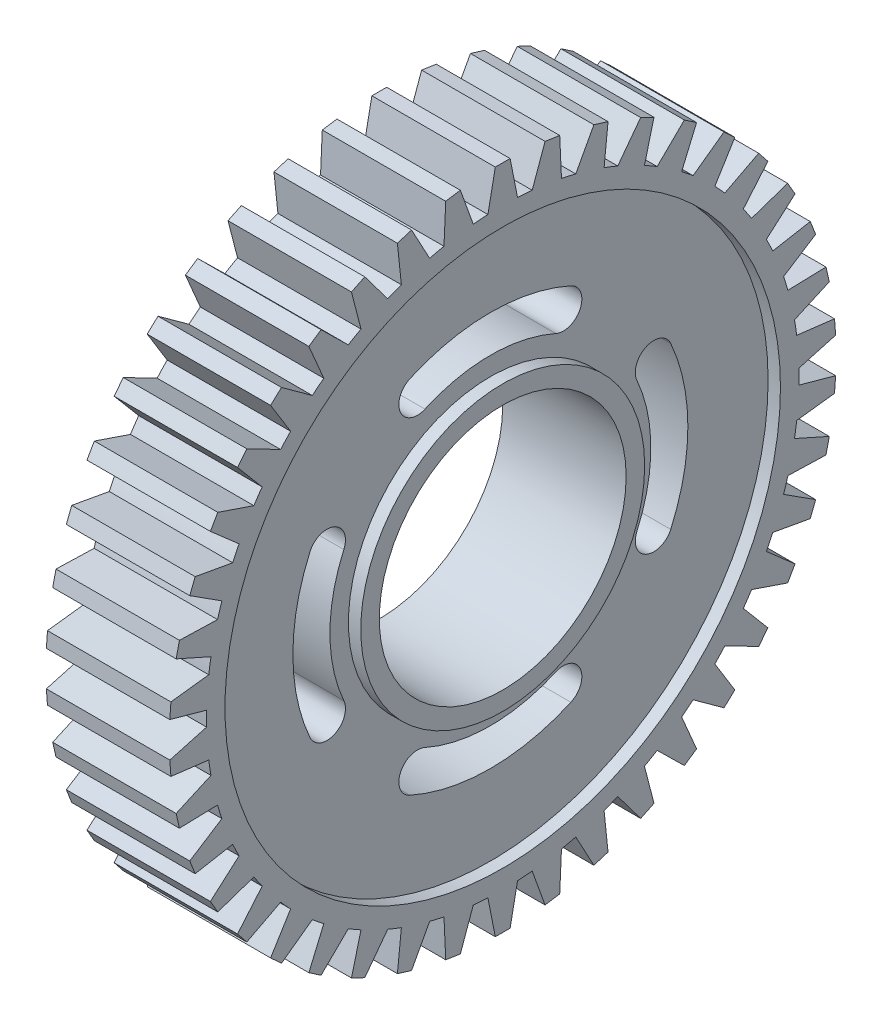
from build123d import *

# Parameters (mm, degrees)
SKETCH1_R           = 22.5
SKETCH1_R_2         = 16
SKETCH1_R_3         = 13
SKETCH1_R_4         = 10
SKETCH1_R_5         = 11.5
BOSS_EXTRUDE1_DEPTH = 4
SKETCH1_3_R         = 24
SKETCH1_3_R_2       = 22.5
SKETCH1_3_R_3       = 11.5
SKETCH1_3_R_4       = 10
BOSS_EXTRUDE2_DEPTH = 5
BOSS_EXTRUDE3_DEPTH = 5
CIRPATTERN2_COUNT   = 42
CUT_EXTRUDE1_DEPTH  = 40.208995541
FILLET1_START       = -4
FILLET1_DEPTH       = 8
FILLET2_START       = -4
FILLET2_DEPTH       = 8
CIRPATTERN3_COUNT   = 4


with BuildPart() as part:
    # Sketch1 → Boss-Extrude1 (new, symmetric)
    # profile 1 of 4: a face of its own
    with BuildSketch(Plane.YZ):
        with Locations(Location((0, 0, 0), (0, 0, 270))):
            Circle(SKETCH1_R)
        Circle(SKETCH1_R_2, mode=Mode.SUBTRACT)
    # profile 2 of 4: a face of its own
    with BuildSketch(Plane.YZ):
        Circle(SKETCH1_R_2)
        Circle(SKETCH1_R_3, mode=Mode.SUBTRACT)
    # profile 3 of 4: a face of its own
    with BuildSketch(Plane.YZ):
        Circle(SKETCH1_R_3)
        with Locations(Location((0, 0, 0), (0, 0, 270))):
            Circle(SKETCH1_R_4, mode=Mode.SUBTRACT)
    # profile 4 of 4: a face of its own
    with BuildSketch(Plane.YZ):
        Circle(SKETCH1_R_5)
        with Locations(Location((0, 0, 0), (0, 0, 270))):
            Circle(SKETCH1_R_4, mode=Mode.SUBTRACT)
    extrude(amount=BOSS_EXTRUDE1_DEPTH, both=True)

    # Sketch1<3> → Boss-Extrude2 (add, symmetric)
    # profile 1 of 2: a face of its own
    with BuildSketch(Plane.YZ):
        with Locations(Location((0, 0, 0), (0, 0, 270))):
            Circle(SKETCH1_3_R)
        with Locations(Location((0, 0, 0), (0, 0, 270))):
            Circle(SKETCH1_3_R_2, mode=Mode.SUBTRACT)
    # profile 2 of 2: a face of its own
    with BuildSketch(Plane.YZ):
        with Locations(Location((0, 0, 0), (0, 0, 270))):
            Circle(SKETCH1_3_R_3)
        with Locations(Location((0, 0, 0), (0, 0, 270))):
            Circle(SKETCH1_3_R_4, mode=Mode.SUBTRACT)
    extrude(amount=BOSS_EXTRUDE2_DEPTH, both=True)

    # Sketch1<4> → Boss-Extrude3 (add, symmetric)
    with BuildSketch(Plane.YZ):
        with BuildLine():
            Line((27, -0.6), (27, 0.6))
            Line((27, 0.6), (23.969981227, 1.2))
            ThreePointArc((23.969981227, 1.2), (23.992494133, 0.600187705), (24, 0))
            ThreePointArc((24, 0), (23.992494133, -0.600187705), (23.969981227, -1.2))
            Line((23.969981227, -1.2), (27, -0.6))
        make_face()
    boss_extrude3 = extrude(amount=BOSS_EXTRUDE3_DEPTH, both=True)

    # CirPattern2: Boss-Extrude3 ×42 about axis
    cirpattern2_axis = Axis((0, 0, 0), (1, 0, 0))
    for i in range(1, CIRPATTERN2_COUNT):
        add(boss_extrude3.rotate(cirpattern2_axis, i * 360 / CIRPATTERN2_COUNT))

    # Sketch2 → Cut-Extrude1 (cut, through all)
    with BuildSketch(Plane.YZ.offset(4)):
        with BuildLine():
            Line((-6.5, 11.258330249), (-8, 13.856406461))
            ThreePointArc((-8, 13.856406461), (0, 16), (8, 13.856406461))
            Line((8, 13.856406461), (6.5, 11.258330249))
            ThreePointArc((6.5, 11.258330249), (0, 13), (-6.5, 11.258330249))
        make_face()
    cut_extrude1 = extrude(amount=-CUT_EXTRUDE1_DEPTH, mode=Mode.SUBTRACT)

    # Fillet1: read off the stored shape, not the designer's step
    # Fillet1 outline → Fillet1 (add)
    with BuildSketch(Plane.YZ.offset(FILLET1_START)):
        with BuildLine():
            ThreePointArc((-6.5, 11.258330249), (-5.908165679, 11.579878165), (-5.300471571, 11.870341239))
            add(Edge.make_bspline(
                [(-5.300471571, 11.870341239), (-5.620971033, 11.727228395), (-6.029597711, 11.655683843), (-6.496578364, 11.727639413), (-6.932882317, 12.008104407), (-7.211102557, 12.489996008)],
                knots=[0, 0, 0, 0, 0, 0, 0.474068369, 0.474068369, 0.474068369, 0.474068369, 0.474068369, 0.474068369], degree=5, weights=[1, 0.810372652, 0.665693468, 0.565962448, 0.511179591, 0.501344899]))
            Line((-7.211102557, 12.489996008), (-6.5, 11.258330249))
        make_face()
        with BuildLine():
            Line((-8, 13.856406461), (-7.211102557, 12.489996008))
            add(Edge.make_bspline(
                [(-7.211102557, 12.489996008), (-7.532816375, 13.047220697), (-7.525071775, 13.652742609), (-7.25906479, 14.138057657), (-6.888560972, 14.446710078), (-6.523657318, 14.609650755)],
                knots=[0.474068369, 0.474068369, 0.474068369, 0.474068369, 0.474068369, 0.474068369, 1, 1, 1, 1, 1, 1], degree=5, weights=[0.501344899, 0.490434287, 0.534844491, 0.634575511, 0.789627348, 1]))
            ThreePointArc((-6.523657318, 14.609650755), (-7.271588528, 14.252157742), (-8, 13.856406461))
        make_face()
    fillet1 = extrude(amount=FILLET1_DEPTH)

    # Fillet2: read off the stored shape, not the designer's step
    # Fillet2 outline → Fillet2 (add)
    with BuildSketch(Plane.YZ.offset(FILLET2_START)):
        with BuildLine():
            ThreePointArc((8, 13.856406461), (7.271588528, 14.252157742), (6.523657319, 14.609650756))
            add(Edge.make_bspline(
                [(6.523657319, 14.609650756), (6.888562826, 14.44670925), (7.259068489, 14.138054575), (7.525075573, 13.652735679), (7.532816511, 13.047210101), (7.211096245, 12.489985075)],
                knots=[0, 0, 0, 0, 0, 0, 0.52593374, 0.52593374, 0.52593374, 0.52593374, 0.52593374, 0.52593374], degree=5, weights=[1, 0.789626504, 0.634574268, 0.534843291, 0.490433575, 0.501345118]))
            Line((7.211096245, 12.489985075), (8, 13.856406461))
        make_face()
        with BuildLine():
            Line((6.5, 11.258330249), (7.211096245, 12.489985075))
            add(Edge.make_bspline(
                [(7.211096245, 12.489985075), (6.932873718, 12.008098879), (6.496571031, 11.727638283), (6.029593284, 11.655684618), (5.620969274, 11.727229181), (5.300471572, 11.870341239)],
                knots=[0.52593374, 0.52593374, 0.52593374, 0.52593374, 0.52593374, 0.52593374, 1, 1, 1, 1, 1, 1], degree=5, weights=[0.501345118, 0.511180567, 0.565963779, 0.665694756, 0.810373496, 1]))
            ThreePointArc((5.300471572, 11.870341239), (5.908165679, 11.579878165), (6.5, 11.258330249))
        make_face()
    fillet2 = extrude(amount=FILLET2_DEPTH)

    # CirPattern3: Cut-Extrude1, Fillet1, Fillet2 ×4 about axis
    cirpattern3_axis = Axis((0, 0, 0), (-1, 0, 0))
    add([cut_extrude1.rotate(cirpattern3_axis, i * 360 / CIRPATTERN3_COUNT) for i in range(1, CIRPATTERN3_COUNT)], mode=Mode.SUBTRACT)
    add([fillet1.rotate(cirpattern3_axis, i * 360 / CIRPATTERN3_COUNT) for i in range(1, CIRPATTERN3_COUNT)])
    add([fillet2.rotate(cirpattern3_axis, i * 360 / CIRPATTERN3_COUNT) for i in range(1, CIRPATTERN3_COUNT)])


solid = part.part
